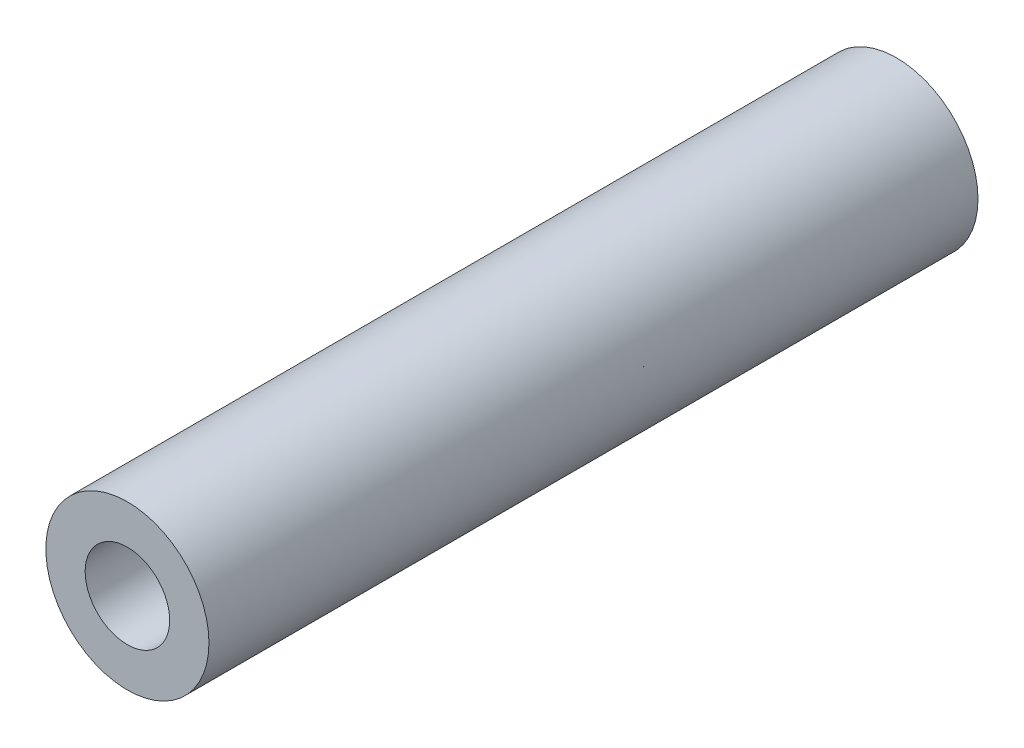
from build123d import *

# Parameters (mm, degrees)
SKETCH1_R                      = 5
BOSS_EXTRUDE1_DEPTH            = 47.15
F_6_0_204_DIAMETER_HOLE1_D     = 5.1816
F_6_0_204_DIAMETER_HOLE1_DEPTH = 30
F_6_0_204_DIAMETER_HOLE1_TIP   = 1.556709692
F_6_0_204_DIAMETER_HOLE2_D     = 5.1816
F_6_0_204_DIAMETER_HOLE2_DEPTH = 30
F_6_0_204_DIAMETER_HOLE2_TIP   = 1.556709692


with BuildPart() as part:
    # Sketch1 → Boss-Extrude1 (new body)
    with BuildSketch(Plane.XY):
        Circle(SKETCH1_R)
    extrude(amount=BOSS_EXTRUDE1_DEPTH)

    # #6 (0.204) Diameter Hole1
    with Locations(Plane(origin=(0, 0, 0), x_dir=(-1, 0, 0), z_dir=(0, 0, -1))):
        with Locations((0, 0)):
            Hole(F_6_0_204_DIAMETER_HOLE1_D / 2, depth=F_6_0_204_DIAMETER_HOLE1_DEPTH)
            with Locations((0, 0, -(F_6_0_204_DIAMETER_HOLE1_DEPTH + F_6_0_204_DIAMETER_HOLE1_TIP / 2))):  # 118° drill point
                Cone(0, F_6_0_204_DIAMETER_HOLE1_D / 2, F_6_0_204_DIAMETER_HOLE1_TIP, mode=Mode.SUBTRACT)

    # #6 (0.204) Diameter Hole2
    with Locations(Plane.XY.offset(47.15)):
        with Locations((0, 0)):
            Hole(F_6_0_204_DIAMETER_HOLE2_D / 2, depth=F_6_0_204_DIAMETER_HOLE2_DEPTH)
            with Locations((0, 0, -(F_6_0_204_DIAMETER_HOLE2_DEPTH + F_6_0_204_DIAMETER_HOLE2_TIP / 2))):  # 118° drill point
                Cone(0, F_6_0_204_DIAMETER_HOLE2_D / 2, F_6_0_204_DIAMETER_HOLE2_TIP, mode=Mode.SUBTRACT)


solid = part.part
